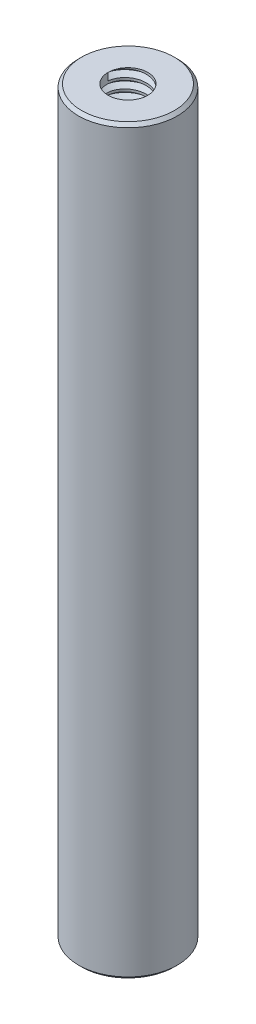
from build123d import *
from build123d.topology import SkipClean

# Parameters (mm, degrees)
CROQUIS2_R              = 6.35
SALIENTE_EXTRUIR1_DEPTH = 47.625
CHAFL_N1_SIZE           = 0.396875
TAP_START               = 47.625
CROQUIS3_R              = 2.5527
TAP_HOLE_1_DEPTH        = 19.05
TAP_START_2             = -28.575
CROQUIS3_2_R            = 2.5527
TAP_HOLE_2_DEPTH        = 19.05
ROSCA1_PITCH            = 1.27
ROSCA2_PITCH            = 1.27


with BuildPart() as part:
    # Croquis2 → Saliente-Extruir1 (new, symmetric)
    with BuildSketch(Plane(origin=(0, 0, 0), x_dir=(1, 0, 0), z_dir=(0, 1, 0))):
        with Locations(Location((0, 0, 0), (0, 0, 270))):
            Circle(CROQUIS2_R)
    extrude(amount=SALIENTE_EXTRUIR1_DEPTH, both=True)

    # Chaflán1
    chafl_n1_edges = [part.edges().sort_by_distance(p)[0] for p in [
        (0, -47.625, -6.35),
        (0, 47.625, -6.35),
    ]]
    chamfer(chafl_n1_edges, length=CHAFL_N1_SIZE)

    # Croquis3 → Tap Hole 1 (cut)
    with BuildSketch(Plane(origin=(0, 0, 0), x_dir=(1, 0, 0), z_dir=(0, 1, 0)).offset(TAP_START)):
        with Locations(Location((0, 0, 0), (0, 0, 270))):
            Circle(CROQUIS3_R)
    extrude(amount=-TAP_HOLE_1_DEPTH, mode=Mode.SUBTRACT)

    # Croquis3<2> → Tap Hole 2 (cut)
    with BuildSketch(Plane(origin=(0, 0, 0), x_dir=(1, 0, 0), z_dir=(0, 1, 0)).offset(TAP_START_2)):
        with Locations(Location((0, 0, 0), (0, 0, 270))):
            Circle(CROQUIS3_2_R)
    extrude(amount=-TAP_HOLE_2_DEPTH, mode=Mode.SUBTRACT)

    # Rosca1: the profile of Perfil de rosca1 profile screwed along a right-hand helix of 15 turns, 8 arcs to a turn; built about Z, then put on its axis
    with SkipClean():  # the faces are left unmerged after this step: merging them gives an invalid solid
        rosca1_z = Axis((0, 0, 0), (0, 0, 1))
        rosca1_corners = [(2.5524, 0, -0.000173205), (3.240107661, 0, 0.396874998), (3.240107661, 0, 0.555624998), (2.5524, 0, 0.952673202)]
        with BuildLine(mode=Mode.PRIVATE) as rosca1_profile:
            Line(rosca1_corners[0], rosca1_corners[1])
            Line(rosca1_corners[1], rosca1_corners[2])
            Line(rosca1_corners[2], rosca1_corners[3])
            Line(rosca1_corners[3], rosca1_corners[0])
        rosca1_cap = Face(rosca1_profile.wire())
        rosca1_turn_angles = [0, 22.5, 45, 67.5, 90, 112.5, 135, 157.5, 180, 202.5, 225, 247.5, 270, 292.5, 315, 337.5, 360]
        rosca1_turn_weights = [1, 0.9238795325112867, 1, 0.9238795325112867, 1, 0.9238795325112867, 1, 0.9238795325112867, 1, 0.9238795325112867, 1, 0.9238795325112867, 1, 0.9238795325112867, 1, 0.9238795325112867, 1]
        rosca1_turn_rails = [Edge.make_bspline([Vector(p[0], p[1], 0).rotate(rosca1_z, rosca1_turn_angles[k]) / rosca1_turn_weights[k] + Vector(0, 0, p[2] + ROSCA1_PITCH * rosca1_turn_angles[k] / 360) for k in range(17)], [0, 0, 0, 1, 1, 2, 2, 3, 3, 4, 4, 5, 5, 6, 6, 7, 7, 8, 8, 8], 2, rosca1_turn_weights) for p in rosca1_corners]
        rosca1_turn_sides = [Face.make_surface_from_curves(rosca1_turn_rails[p[0]], rosca1_turn_rails[p[1]]) for p in [(0, 1), (1, 2), (2, 3), (3, 0)]]
        rosca1 = Plane(origin=(0, 47.625, 0), x_dir=(-1, 0, 0), z_dir=(0, -1, 0)) * Solid(Shell([*[p.moved(Location((0, 0, ROSCA1_PITCH * i))) for i in range(15) for p in rosca1_turn_sides], rosca1_cap, rosca1_cap.rotate(rosca1_z, 5400).moved(Location((0, 0, ROSCA1_PITCH * 5400 / 360)))]))
        add(rosca1, mode=Mode.SUBTRACT)

    # Rosca2: the profile of Perfil de rosca2 profile screwed along a right-hand helix of 15 turns, 8 arcs to a turn; built about Z, then put on its axis
    with SkipClean():  # the faces are left unmerged after this step: merging them gives an invalid solid
        rosca2_z = Axis((0, 0, 0), (0, 0, 1))
        rosca2_corners = [(2.5524, 0, -0.000173205), (3.240107661, 0, 0.396874998), (3.240107661, 0, 0.555624998), (2.5524, 0, 0.952673202)]
        with BuildLine(mode=Mode.PRIVATE) as rosca2_profile:
            Line(rosca2_corners[0], rosca2_corners[1])
            Line(rosca2_corners[1], rosca2_corners[2])
            Line(rosca2_corners[2], rosca2_corners[3])
            Line(rosca2_corners[3], rosca2_corners[0])
        rosca2_cap = Face(rosca2_profile.wire())
        rosca2_turn_angles = [0, 22.5, 45, 67.5, 90, 112.5, 135, 157.5, 180, 202.5, 225, 247.5, 270, 292.5, 315, 337.5, 360]
        rosca2_turn_weights = [1, 0.9238795325112867, 1, 0.9238795325112867, 1, 0.9238795325112867, 1, 0.9238795325112867, 1, 0.9238795325112867, 1, 0.9238795325112867, 1, 0.9238795325112867, 1, 0.9238795325112867, 1]
        rosca2_turn_rails = [Edge.make_bspline([Vector(p[0], p[1], 0).rotate(rosca2_z, rosca2_turn_angles[k]) / rosca2_turn_weights[k] + Vector(0, 0, p[2] + ROSCA2_PITCH * rosca2_turn_angles[k] / 360) for k in range(17)], [0, 0, 0, 1, 1, 2, 2, 3, 3, 4, 4, 5, 5, 6, 6, 7, 7, 8, 8, 8], 2, rosca2_turn_weights) for p in rosca2_corners]
        rosca2_turn_sides = [Face.make_surface_from_curves(rosca2_turn_rails[p[0]], rosca2_turn_rails[p[1]]) for p in [(0, 1), (1, 2), (2, 3), (3, 0)]]
        rosca2 = Plane(origin=(0, -47.625, 0), x_dir=(1, 0, 0), z_dir=(0, 1, 0)) * Solid(Shell([*[p.moved(Location((0, 0, ROSCA2_PITCH * i))) for i in range(15) for p in rosca2_turn_sides], rosca2_cap, rosca2_cap.rotate(rosca2_z, 5400).moved(Location((0, 0, ROSCA2_PITCH * 5400 / 360)))]))
        add(rosca2, mode=Mode.SUBTRACT)


solid = part.part
